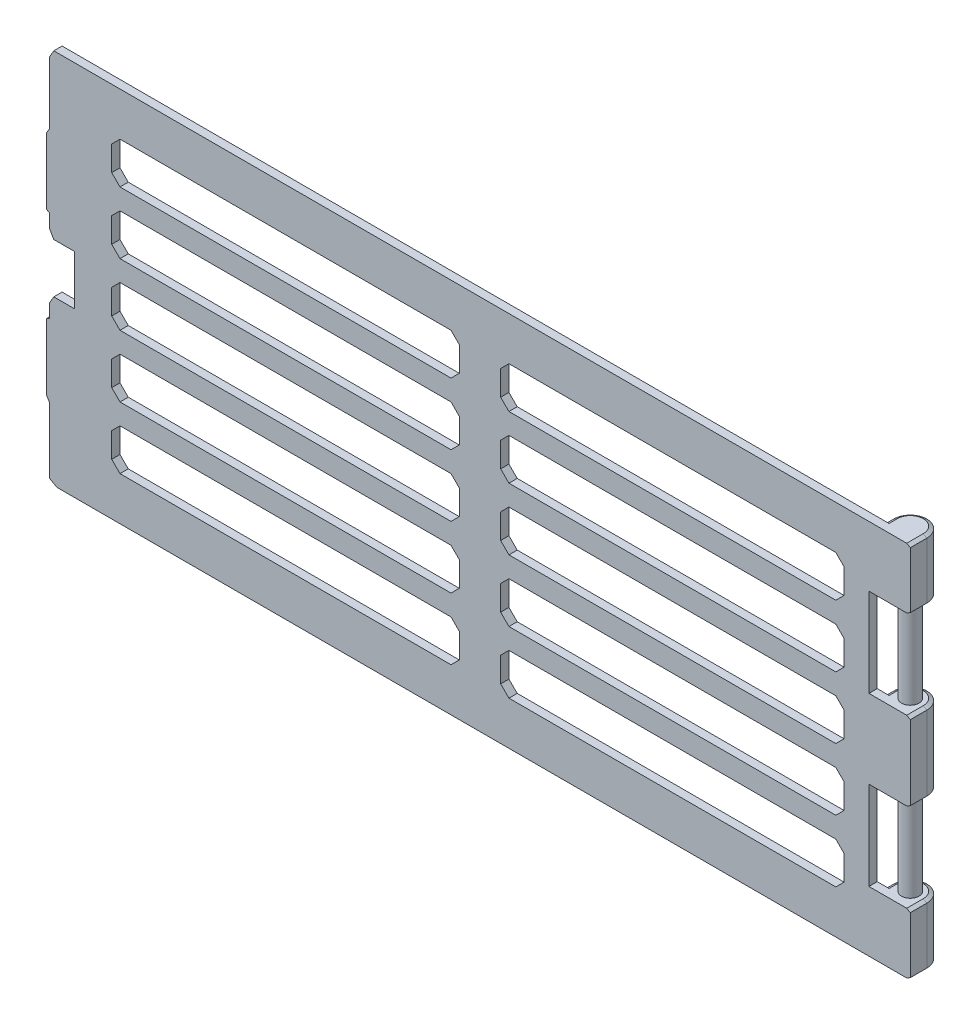
from build123d import *
from OCP.BRepFilletAPI import BRepFilletAPI_MakeChamfer

# Parameters (mm, degrees)
SKETCH_1_W             = 208
SKETCH_1_H             = 91
EXTRUDE_1_DEPTH        = 2
SKETCH_3_W             = 8
SKETCH_3_H             = 8
EXTRUDE_2_DEPTH        = 91
SKETCH_2_W             = 10
SKETCH_2_H             = 21.4
CUT_EXTRUDE_1_DEPTH    = 23
EXTRUDE_START          = -76.4
SKETCH_4_R             = 2.1
EXTRUDE_3_DEPTH        = 61.8
FILLET_1_R             = 4
SKETCH_6_W             = 177
SKETCH_6_H             = 10
CUT_EXTRUDE_1_2_DEPTH  = 114.799165199
SKETCH_7_W             = 10
SKETCH_7_H             = 91
EXTRUDE_4_DEPTH        = 2
CHAMFER_1_SIZE         = 2
SKETCH_8_W             = 12
SKETCH_8_H             = 12
CUT_EXTRUDE_3_DEPTH    = 10
EXTRUDE_START_2        = 12
EXTRUDE_5_DEPTH        = 15
FILLET_2_R             = 1.5
FILLET_2_OF_MIRROR_2_R = 1.5
CHAMFER_2_SIZE         = 1
CHAMFER_2_SIZE_2       = 1.732050808
CHAMFER_3_SIZE         = 0.5
CHAMFER_3_SIZE2        = 0.866025404


# Some blends are built 0.0001 mm under size
with BuildPart() as part:
    # 草图1 → 凸台-拉伸1 (new body)
    with BuildSketch(Plane.XY):
        Rectangle(SKETCH_1_W, SKETCH_1_H)
    extrude(amount=EXTRUDE_1_DEPTH)

    # 草图3 → 凸台-拉伸2 (add)
    with BuildSketch(Plane(origin=(0, 45.5, 0), x_dir=(1, 0, 0), z_dir=(0, 1, 0))):
        with Locations((100, 2)):
            Rectangle(SKETCH_3_W, SKETCH_3_H)
    extrude(amount=-EXTRUDE_2_DEPTH)

    # 草图2 → Cut-Extrude 1 (cut, symmetric)
    with BuildSketch(Plane.XY.offset(2)):
        with Locations((99, 20.2)):
            Rectangle(SKETCH_2_W, SKETCH_2_H)
        with Locations((99, -20.2)):
            Rectangle(SKETCH_2_W, SKETCH_2_H)
    extrude(amount=CUT_EXTRUDE_1_DEPTH, both=True, mode=Mode.SUBTRACT)

    # 草图4 → 凸台-拉伸3 (add)
    with BuildSketch(Plane(origin=(0, 45.5, 0), x_dir=(1, 0, 0), z_dir=(0, 1, 0)).offset(EXTRUDE_START)):
        with Locations(Location((100, 2, 0), (0, 0, 270))):
            Circle(SKETCH_4_R)
    extrude(amount=EXTRUDE_3_DEPTH)

    # 圆角1
    fillet_1_edges = [part.edges().sort_by_distance(p)[0] for p in [
        (96, 38.2, -6),
        (96, 0, -6),
        (96, -38.2, -6),
        (104, -38.2, -6),
        (104, 0, -6),
        (104, 38.2, -6),
    ]]
    fillet(fillet_1_edges, radius=FILLET_1_R - 0.0001)  # a hair under: the kernel refuses the full size

    # 草图6 → Cut-Extrude 1 2 (cut, through all)
    with BuildSketch(Plane.XY.offset(2)):
        with Locations((-0.5, 0)):
            Rectangle(SKETCH_6_W, SKETCH_6_H)
        with Locations((-0.5, 15)):
            Rectangle(SKETCH_6_W, SKETCH_6_H)
        with Locations((-0.5, 30)):
            Rectangle(SKETCH_6_W, SKETCH_6_H)
    cut_extrude_1_2 = extrude(amount=-CUT_EXTRUDE_1_2_DEPTH, mode=Mode.SUBTRACT)

    # 镜向1: Cut-Extrude 1 2 across plane
    add(cut_extrude_1_2.mirror(Plane.ZX), mode=Mode.SUBTRACT)

    # 草图7 → 凸台-拉伸4 (add)
    with BuildSketch(Plane.XY.offset(2)):
        Rectangle(SKETCH_7_W, SKETCH_7_H)
    extrude(amount=-EXTRUDE_4_DEPTH)

    # 倒角1
    chamfer_1_edges = [part.edges().sort_by_distance(p)[0] for p in [
        (-89, 35, 1),
        (88, 35, 1),
        (88, 25, 1),
        (-89, 25, 1),
        (-89, 20, 1),
        (88, 20, 1),
        (88, 10, 1),
        (-89, 10, 1),
        (88, -5, 1),
        (-89, -5, 1),
        (-89, 5, 1),
        (88, 5, 1),
        (88, -35, 1),
        (-89, -35, 1),
        (-89, -25, 1),
        (88, -25, 1),
        (88, -20, 1),
        (-89, -20, 1),
        (-89, -10, 1),
        (88, -10, 1),
        (-5, -25, 1),
        (5, -25, 1),
        (5, 5, 1),
        (5, 10, 1),
        (5, -5, 1),
        (5, -10, 1),
        (5, 25, 1),
        (5, 20, 1),
        (5, -20, 1),
        (5, -35, 1),
        (-5, 5, 1),
        (-5, 10, 1),
        (-5, -5, 1),
        (-5, -10, 1),
        (-5, 25, 1),
        (-5, 20, 1),
        (-5, -20, 1),
        (-5, -35, 1),
        (5, 35, 1),
        (-5, 35, 1),
    ]]
    chamfer(chamfer_1_edges, length=CHAMFER_1_SIZE)

    # 草图8 → 切除-拉伸3 (cut)
    with BuildSketch(Plane.XY.offset(2)):
        with Locations((-104, 0)):
            Rectangle(SKETCH_8_W, SKETCH_8_H)
    extrude(amount=-CUT_EXTRUDE_3_DEPTH, mode=Mode.SUBTRACT)

    # 草图9 → 凸台-拉伸5 (add)
    with BuildSketch(Plane(origin=(0, 0, 0), x_dir=(1, 0, 0), z_dir=(0, 1, 0)).offset(EXTRUDE_START_2)):
        Polygon((-104, 1.187867966), (-104, -2), (-102, -2), (-102, 1.187867966), (-103.012132034, 2.2), (-102, 3.212132034), (-102, 4.5), (-104, 4.5), (-104, 3.212132034), align=None)
        Polygon((-104.8, 2.2), (-104, 1.187867966), (-104, 3.212132034), align=None)
        Polygon((-104.8, -2), (-104, -2), (-104, 1.187867966), (-104.8, 2.2), align=None)
    extrude_5 = extrude(amount=EXTRUDE_5_DEPTH)

    # 圆角2
    fillet_2_edges = [part.edges().sort_by_distance(p)[0] for p in [
        (-104, 19.5, -3.212132034),
        (-104.8, 19.5, -2.2),
    ]]
    fillet(fillet_2_edges, radius=FILLET_2_R)

    # 镜向2: 凸台-拉伸5 across plane
    add(extrude_5.mirror(Plane.ZX))

    # 圆角2 of 镜向2
    fillet_2_of_mirror_2_edges = [part.edges().sort_by_distance(p)[0] for p in [
        (-104, -19.5, -3.212132034),
        (-104.8, -19.5, -2.2),
    ]]
    fillet(fillet_2_of_mirror_2_edges, radius=FILLET_2_OF_MIRROR_2_R)

    # 倒角2
    # the kernel refuses this chamfer: 1.732050808, 1 mm, written as the material it adds along each edge
    with BuildSketch(Plane(origin=(-104, -27, 2), x_dir=(-0.9983227437537928, 0.05789386240266947, 0), z_dir=(0, 0, -1))) as chamfer_2_piece_1_section:
        Polygon((CHAMFER_2_SIZE * 0.998322743754, -CHAMFER_2_SIZE * 0.0578938624027), (-CHAMFER_2_SIZE_2 * 0.0578938623883, -CHAMFER_2_SIZE_2 * 0.998322743505), (0, 0), align=None)
    chamfer_2_piece_1 = extrude(amount=2, mode=Mode.PRIVATE)
    chamfer_2_piece_1 = split(chamfer_2_piece_1, bisect_by=Plane(origin=(-104.8, -27.609428654, 1), z_dir=(1, 0, 0)), keep=Keep.TOP, mode=Mode.PRIVATE)
    add(chamfer_2_piece_1)
    with BuildSketch(Plane(origin=(-104, 12, 2), x_dir=(0.05789386240267317, -0.9983227437537924, 0), z_dir=(0, 0, -1))) as chamfer_2_piece_2_section:
        Polygon((CHAMFER_2_SIZE * 0.998322743754, CHAMFER_2_SIZE * 0.0578938624027), (-CHAMFER_2_SIZE_2 * 0.0578938623883, CHAMFER_2_SIZE_2 * 0.998322743505), (0, 0), align=None)
    chamfer_2_piece_2 = extrude(amount=2, mode=Mode.PRIVATE)
    chamfer_2_piece_2 = split(chamfer_2_piece_2, bisect_by=Plane(origin=(-104.8, 11.604413214, 1), z_dir=(1, 0, 0)), keep=Keep.TOP, mode=Mode.PRIVATE)
    add(chamfer_2_piece_2)
    with BuildSketch(Plane(origin=(-104, -12, 2), x_dir=(-0.9998132206222079, -0.019326765612700723, 0), z_dir=(0, 0, -1))) as chamfer_2_piece_3_section:
        Polygon((CHAMFER_2_SIZE_2 * 0.999813220373, CHAMFER_2_SIZE_2 * 0.0193267656079), (-CHAMFER_2_SIZE * 0.0193267656127, CHAMFER_2_SIZE * 0.999813220622), (0, 0), align=None)
    chamfer_2_piece_3 = extrude(amount=2, mode=Mode.PRIVATE)
    chamfer_2_piece_3 = split(chamfer_2_piece_3, bisect_by=Plane(origin=(-104.8, -11.604413214, 1), z_dir=(1, 0, 0)), keep=Keep.TOP, mode=Mode.PRIVATE)
    add(chamfer_2_piece_3)
    with BuildSketch(Plane(origin=(-104, 27, 2), x_dir=(-0.9983227437537928, -0.05789386240266947, 0), z_dir=(0, 0, -1))) as chamfer_2_piece_4_section:
        Polygon((CHAMFER_2_SIZE * 0.998322743754, CHAMFER_2_SIZE * 0.0578938624027), (-CHAMFER_2_SIZE_2 * 0.0578938623883, CHAMFER_2_SIZE_2 * 0.998322743505), (0, 0), align=None)
    chamfer_2_piece_4 = extrude(amount=2, mode=Mode.PRIVATE)
    chamfer_2_piece_4 = split(chamfer_2_piece_4, bisect_by=Plane(origin=(-104.8, 27.609428654, 1), z_dir=(1, 0, 0)), keep=Keep.TOP, mode=Mode.PRIVATE)
    add(chamfer_2_piece_4)
    # the kernel refuses this chamfer: 1.732050808, 1 mm, written as the material it takes off along each edge
    with BuildSketch(Plane(origin=(-104, -45.5, -4.480963971), x_dir=(-0.05789386240267328, 0.9983227437537926, 0), z_dir=(0, 0, 1)), Plane(origin=(-104, -6, -4.480963971), x_dir=(0.9983227437537926, 0.05789386240267117, 0), z_dir=(0, 0, 1)), Plane(origin=(-104, 45.5, -4.480963971), x_dir=(0.9983227437537926, 0.057893862402672885, 0), z_dir=(0, 0, 1))) as chamfer_2_2_piece_1:
        Polygon((CHAMFER_2_SIZE * 0.998322743754, -CHAMFER_2_SIZE * 0.0578938624027), (-CHAMFER_2_SIZE_2 * 0.0578938623883, -CHAMFER_2_SIZE_2 * 0.998322743505), (0, 0), align=None)
    extrude(amount=10.961927941, mode=Mode.SUBTRACT)
    with BuildSketch(Plane(origin=(-104, 6, 6.480963971), x_dir=(-0.019326765612703713, 0.9998132206222079, 0), z_dir=(0, 0, -1))) as chamfer_2_2_piece_2:
        Polygon((CHAMFER_2_SIZE_2 * 0.999813220373, CHAMFER_2_SIZE_2 * 0.0193267656079), (-CHAMFER_2_SIZE * 0.0193267656127, CHAMFER_2_SIZE * 0.999813220622), (0, 0), align=None)
    extrude(amount=10.961927941, mode=Mode.SUBTRACT)

    # 倒角3: one chamfer whose edges measure the first distance from different faces: ONE call of the kernel's chamfer builder (chamfer() names one face for all edges)
    chamfer_3_edges_1 = [part.edges().sort_by_distance(p)[0] for p in [
        (96, 45.5, -1.00005),
        (96, 30.9, -1.00005),
    ]]
    chamfer_3_side_1 = [part.faces().sort_by_distance(p)[0] for p in [
        (96, 38.2, -1.00005),
    ]]
    chamfer_3_edges_2 = [part.edges().sort_by_distance(p)[0] for p in [
        (102.828456414, 45.5, -4.828456414),
        (102.828456414, 30.9, -4.828456414),
    ]]
    chamfer_3_side_2 = [part.faces().sort_by_distance(p)[0] for p in [
        (102.828456414, 38.2, -4.828456414),
    ]]
    chamfer_3_edges_3 = [part.edges().sort_by_distance(p)[0] for p in [
        (97.171543586, 45.5, -4.828456414),
        (97.171543586, 30.9, -4.828456414),
    ]]
    chamfer_3_side_3 = [part.faces().sort_by_distance(p)[0] for p in [
        (97.171543586, 38.2, -4.828456414),
    ]]
    chamfer_3_edges_4 = [part.edges().sort_by_distance(p)[0] for p in [
        (104, 30.9, -5e-05),
        (104, 45.5, -5e-05),
    ]]
    chamfer_3_side_4 = [part.faces().sort_by_distance(p)[0] for p in [
        (104, 38.2, -5e-05),
    ]]
    chamfer_3_edges_5 = [part.edges().sort_by_distance(p)[0] for p in [
        (104, 9.5, -5e-05),
        (104, -9.5, -5e-05),
    ]]
    chamfer_3_side_5 = [part.faces().sort_by_distance(p)[0] for p in [
        (104, 0, -5e-05),
    ]]
    chamfer_3_edges_6 = [part.edges().sort_by_distance(p)[0] for p in [
        (102.828456414, 9.5, -4.828456414),
        (102.828456414, -9.5, -4.828456414),
    ]]
    chamfer_3_side_6 = [part.faces().sort_by_distance(p)[0] for p in [
        (102.828456414, 0, -4.828456414),
    ]]
    chamfer_3_edges_7 = [part.edges().sort_by_distance(p)[0] for p in [
        (97.171543586, 9.5, -4.828456414),
        (97.171543586, -9.5, -4.828456414),
    ]]
    chamfer_3_side_7 = [part.faces().sort_by_distance(p)[0] for p in [
        (97.171543586, 0, -4.828456414),
    ]]
    chamfer_3_edges_8 = [part.edges().sort_by_distance(p)[0] for p in [
        (96, -9.5, -1.00005),
        (96, 9.5, -1.00005),
    ]]
    chamfer_3_side_8 = [part.faces().sort_by_distance(p)[0] for p in [
        (96, 0, -1.00005),
    ]]
    chamfer_3_edges_9 = [part.edges().sort_by_distance(p)[0] for p in [
        (104, -30.9, -5e-05),
        (104, -45.5, -5e-05),
    ]]
    chamfer_3_side_9 = [part.faces().sort_by_distance(p)[0] for p in [
        (104, -38.2, -5e-05),
    ]]
    chamfer_3_edges_10 = [part.edges().sort_by_distance(p)[0] for p in [
        (102.828456414, -30.9, -4.828456414),
        (102.828456414, -45.5, -4.828456414),
    ]]
    chamfer_3_side_10 = [part.faces().sort_by_distance(p)[0] for p in [
        (102.828456414, -38.2, -4.828456414),
    ]]
    chamfer_3_edges_11 = [part.edges().sort_by_distance(p)[0] for p in [
        (97.171543586, -30.9, -4.828456414),
        (97.171543586, -45.5, -4.828456414),
    ]]
    chamfer_3_side_11 = [part.faces().sort_by_distance(p)[0] for p in [
        (97.171543586, -38.2, -4.828456414),
    ]]
    chamfer_3_edges_12 = [part.edges().sort_by_distance(p)[0] for p in [
        (96, -45.5, -1.00005),
        (96, -30.9, -1.00005),
    ]]
    chamfer_3_side_12 = [part.faces().sort_by_distance(p)[0] for p in [
        (96, -38.2, -1.00005),
    ]]
    chamfer_3 = BRepFilletAPI_MakeChamfer(part.part.solid().wrapped)
    for e in chamfer_3_edges_1:
        chamfer_3.Add(CHAMFER_3_SIZE, CHAMFER_3_SIZE2, e.wrapped, chamfer_3_side_1[0].wrapped)  # the first distance lies on this face
    for e in chamfer_3_edges_2:
        chamfer_3.Add(CHAMFER_3_SIZE, CHAMFER_3_SIZE2, e.wrapped, chamfer_3_side_2[0].wrapped)  # the first distance lies on this face
    for e in chamfer_3_edges_3:
        chamfer_3.Add(CHAMFER_3_SIZE, CHAMFER_3_SIZE2, e.wrapped, chamfer_3_side_3[0].wrapped)  # the first distance lies on this face
    for e in chamfer_3_edges_4:
        chamfer_3.Add(CHAMFER_3_SIZE, CHAMFER_3_SIZE2, e.wrapped, chamfer_3_side_4[0].wrapped)  # the first distance lies on this face
    for e in chamfer_3_edges_5:
        chamfer_3.Add(CHAMFER_3_SIZE, CHAMFER_3_SIZE2, e.wrapped, chamfer_3_side_5[0].wrapped)  # the first distance lies on this face
    for e in chamfer_3_edges_6:
        chamfer_3.Add(CHAMFER_3_SIZE, CHAMFER_3_SIZE2, e.wrapped, chamfer_3_side_6[0].wrapped)  # the first distance lies on this face
    for e in chamfer_3_edges_7:
        chamfer_3.Add(CHAMFER_3_SIZE, CHAMFER_3_SIZE2, e.wrapped, chamfer_3_side_7[0].wrapped)  # the first distance lies on this face
    for e in chamfer_3_edges_8:
        chamfer_3.Add(CHAMFER_3_SIZE, CHAMFER_3_SIZE2, e.wrapped, chamfer_3_side_8[0].wrapped)  # the first distance lies on this face
    for e in chamfer_3_edges_9:
        chamfer_3.Add(CHAMFER_3_SIZE, CHAMFER_3_SIZE2, e.wrapped, chamfer_3_side_9[0].wrapped)  # the first distance lies on this face
    for e in chamfer_3_edges_10:
        chamfer_3.Add(CHAMFER_3_SIZE, CHAMFER_3_SIZE2, e.wrapped, chamfer_3_side_10[0].wrapped)  # the first distance lies on this face
    for e in chamfer_3_edges_11:
        chamfer_3.Add(CHAMFER_3_SIZE, CHAMFER_3_SIZE2, e.wrapped, chamfer_3_side_11[0].wrapped)  # the first distance lies on this face
    for e in chamfer_3_edges_12:
        chamfer_3.Add(CHAMFER_3_SIZE, CHAMFER_3_SIZE2, e.wrapped, chamfer_3_side_12[0].wrapped)  # the first distance lies on this face
    add(Compound.cast(chamfer_3.Shape()), mode=Mode.REPLACE)


solid = part.part
